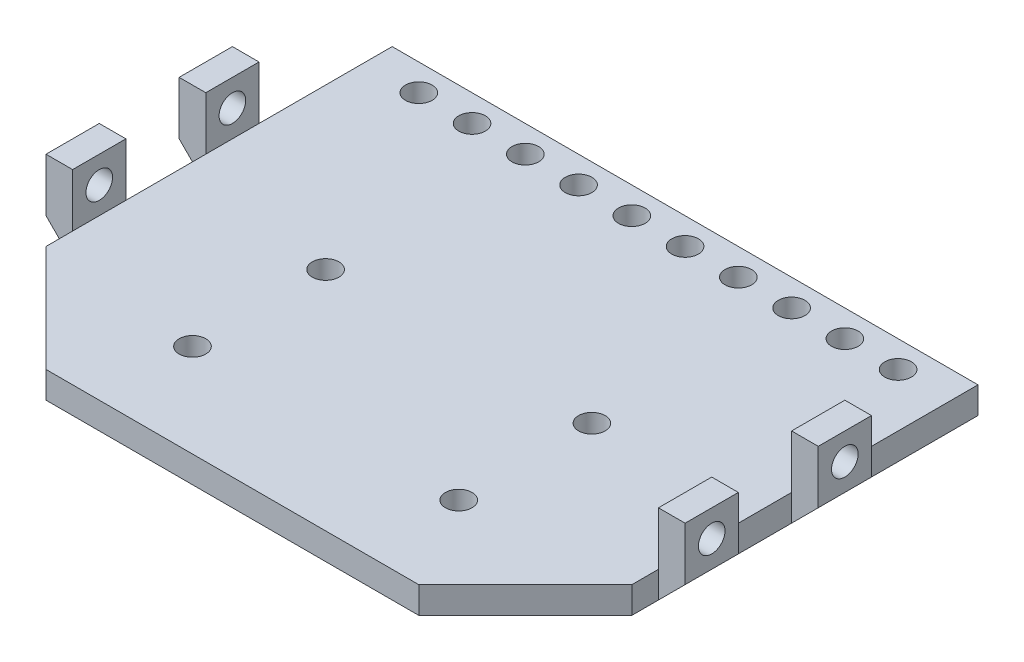
from build123d import *

# Parameters (mm, degrees)
SKETCH1_W           = 120
SKETCH1_H           = 85
BOSS_EXTRUDE1_DEPTH = 5
SKETCH2_W           = 5
SKETCH2_H           = 10
BOSS_EXTRUDE2_DEPTH = 10
SKETCH3_R           = 2.5
CUT_EXTRUDE1_DEPTH  = 129.184437433
SKETCH5_W           = 5
SKETCH5_H           = 25
SKETCH5_H_2         = 15
CUT_EXTRUDE2_DEPTH  = 75.204110398
CHAMFER1_SIZE       = 5
SKETCH6_R           = 2.5
CUT_EXTRUDE3_DEPTH  = 76.041655099
SKETCH7_R           = 2.5
CUT_EXTRUDE4_DEPTH  = 10
CHAMFER2_SIZE       = 20


with BuildPart() as part:
    # Sketch1 → Boss-Extrude1 (new body)
    with BuildSketch(Plane(origin=(0, 0, 0), x_dir=(1, 0, 0), z_dir=(0, 1, 0))):
        Rectangle(SKETCH1_W, SKETCH1_H)
    extrude(amount=BOSS_EXTRUDE1_DEPTH)

    # Sketch2 → Boss-Extrude2 (add)
    with BuildSketch(Plane(origin=(0, 5, 0), x_dir=(1, 0, 0), z_dir=(0, 1, 0))):
        with Locations((-57.5, 12.5)):
            Rectangle(SKETCH2_W, SKETCH2_H)
        with Locations((-57.5, -12.5)):
            Rectangle(SKETCH2_W, SKETCH2_H)
        with Locations((57.5, -12.5)):
            Rectangle(SKETCH2_W, SKETCH2_H)
        with Locations((57.5, 12.5)):
            Rectangle(SKETCH2_W, SKETCH2_H)
    extrude(amount=BOSS_EXTRUDE2_DEPTH)

    # Sketch3 → Cut-Extrude1 (cut, through all)
    with BuildSketch(Plane.ZY.offset(60)):
        with Locations((-12.5, 10)):
            Circle(SKETCH3_R)
        with Locations((12.5, 10)):
            Circle(SKETCH3_R)
    extrude(amount=-CUT_EXTRUDE1_DEPTH, mode=Mode.SUBTRACT)

    # Sketch5 → Cut-Extrude2 (cut, through all)
    with BuildSketch(Plane(origin=(0, 5, 0), x_dir=(1, 0, 0), z_dir=(0, 1, 0))):
        with Locations((-57.5, 30)):
            Rectangle(SKETCH5_W, SKETCH5_H)
        with Locations((-57.5, 0)):
            Rectangle(SKETCH5_W, SKETCH5_H_2)
        with Locations((-57.5, -30)):
            Rectangle(SKETCH5_W, SKETCH5_H)
        with Locations((57.5, -30)):
            Rectangle(SKETCH5_W, SKETCH5_H)
        with Locations((57.5, 0)):
            Rectangle(SKETCH5_W, SKETCH5_H_2)
        with Locations((57.5, 30)):
            Rectangle(SKETCH5_W, SKETCH5_H)
    extrude(amount=-CUT_EXTRUDE2_DEPTH, mode=Mode.SUBTRACT)

    # Chamfer1
    chamfer1_edges = [part.edges().sort_by_distance(p)[0] for p in [
        (-60, 0, 12.5),
        (-60, 0, -12.5),
        (60, 0, -12.5),
        (60, 0, 12.5),
    ]]
    chamfer(chamfer1_edges, length=CHAMFER1_SIZE)

    # Sketch6 → Cut-Extrude3 (cut, through all)
    with BuildSketch(Plane.XZ):
        with Locations((25, 0)):
            Circle(SKETCH6_R)
        with Locations((-25, 0)):
            Circle(SKETCH6_R)
        with Locations((25, 25)):
            Circle(SKETCH6_R)
        with Locations((-25, 25)):
            Circle(SKETCH6_R)
    extrude(amount=-CUT_EXTRUDE3_DEPTH, mode=Mode.SUBTRACT)

    # Sketch7 → Cut-Extrude4 (cut)
    with BuildSketch(Plane.XZ):
        with Locations((-45, -37.5)):
            Circle(SKETCH7_R)
        with Locations((-35, -37.5)):
            Circle(SKETCH7_R)
        with Locations((-25, -37.5)):
            Circle(SKETCH7_R)
        with Locations((-15, -37.5)):
            Circle(SKETCH7_R)
        with Locations((-5, -37.5)):
            Circle(SKETCH7_R)
        with Locations((5, -37.5)):
            Circle(SKETCH7_R)
        with Locations((15, -37.5)):
            Circle(SKETCH7_R)
        with Locations((25, -37.5)):
            Circle(SKETCH7_R)
        with Locations((35, -37.5)):
            Circle(SKETCH7_R)
        with Locations((45, -37.5)):
            Circle(SKETCH7_R)
    extrude(amount=-CUT_EXTRUDE4_DEPTH, mode=Mode.SUBTRACT)

    # Chamfer2
    chamfer2_edges = [part.edges().sort_by_distance(p)[0] for p in [
        (55, 2.5, 42.5),
        (-55, 2.5, 42.5),
    ]]
    chamfer(chamfer2_edges, length=CHAMFER2_SIZE)


solid = part.part
